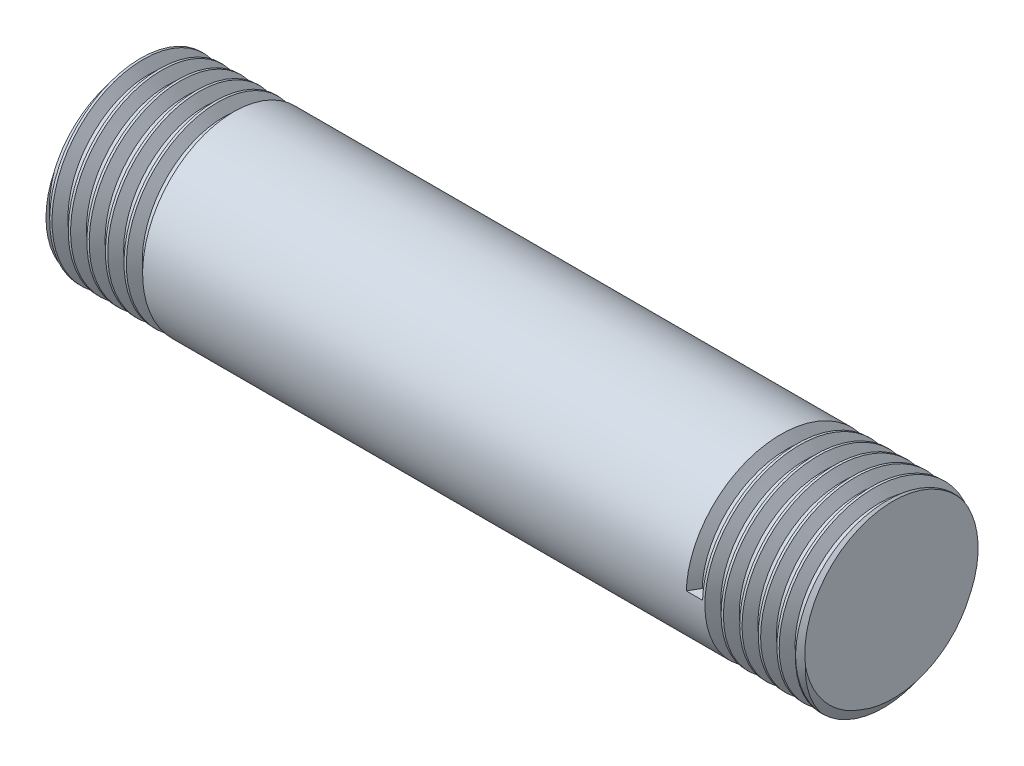
from build123d import *

# Parameters (mm, degrees)
SWEEP1_PROFILE_R = 5
CHAMFER1_SIZE    = 0.25
THREAD1_PITCH    = 1
THREAD2_PITCH    = 1


with BuildPart() as part:
    # Sweep1: sweep along a path in Sketch5
    with BuildLine(Plane.XY) as sweep1_path:
        Line((0, 0), (41, 0))
    # Sweep1 profile (on start of the path) → Sweep1 (sweep)
    with BuildSketch(Plane(origin=(0, 0, 0), x_dir=(0, 0, 1), z_dir=(1, 0, 0))):
        Circle(SWEEP1_PROFILE_R)
    sweep(path=sweep1_path.line)

    # Chamfer1
    chamfer1_edges = [part.edges().sort_by_distance(p)[0] for p in [
        (0, 0, -5),
        (41, 0, -5),
    ]]
    chamfer(chamfer1_edges, length=CHAMFER1_SIZE)

    # Thread1: arcs per turn and ends read off the stored shape
    # Thread1: the profile of Thread Profile1 profile screwed along a left-hand helix through 7 turns, 8 arcs to a turn; built about Z, then put on its axis
    thread1_z = Axis((0, 0, 0), (0, 0, 1))
    thread1_corners = [(5.0003, 0, -0.000173205), (5.0003, 0, 0.875173202), (4.458734125, 0, 0.562499999), (4.458734125, 0, 0.312499999)]
    with BuildLine(mode=Mode.PRIVATE) as thread1_profile:
        Line(thread1_corners[0], thread1_corners[1])
        Line(thread1_corners[1], thread1_corners[2])
        Line(thread1_corners[2], thread1_corners[3])
        Line(thread1_corners[3], thread1_corners[0])
    thread1_cap = Face(thread1_profile.wire())
    thread1_turn_angles = [0, -22.5, -45, -67.5, -90, -112.5, -135, -157.5, -180, -202.5, -225, -247.5, -270, -292.5, -315, -337.5, -360]
    thread1_turn_weights = [1, 0.9238795325112867, 1, 0.9238795325112867, 1, 0.9238795325112867, 1, 0.9238795325112867, 1, 0.9238795325112867, 1, 0.9238795325112867, 1, 0.9238795325112867, 1, 0.9238795325112867, 1]
    thread1_turn_rails = [Edge.make_bspline([Vector(p[0], p[1], 0).rotate(thread1_z, thread1_turn_angles[k]) / thread1_turn_weights[k] + Vector(0, 0, p[2] + -THREAD1_PITCH * thread1_turn_angles[k] / 360) for k in range(17)], [0, 0, 0, 1, 1, 2, 2, 3, 3, 4, 4, 5, 5, 6, 6, 7, 7, 8, 8, 8], 2, thread1_turn_weights) for p in thread1_corners]
    thread1_turn_sides = [Face.make_surface_from_curves(thread1_turn_rails[p[0]], thread1_turn_rails[p[1]]) for p in [(0, 1), (1, 2), (2, 3), (3, 0)]]
    thread1 = Plane(origin=(42.75, 0, 0), x_dir=(0, 0, 1), z_dir=(-1, 0, 0)) * Solid(Shell([*[p.moved(Location((0, 0, THREAD1_PITCH * i))) for i in range(7) for p in thread1_turn_sides], thread1_cap, thread1_cap.rotate(thread1_z, -2520).moved(Location((0, 0, -THREAD1_PITCH * -2520 / 360)))]))
    add(thread1, mode=Mode.SUBTRACT)

    # Thread2: arcs per turn and ends read off the stored shape
    # Thread2: the profile of Thread Profile2 profile screwed along a right-hand helix through 7 turns, 8 arcs to a turn; built about Z, then put on its axis
    thread2_z = Axis((0, 0, 0), (0, 0, 1))
    thread2_corners = [(5.0003, 0, -0.000173205), (5.0003, 0, 0.875173202), (4.458734125, 0, 0.562499999), (4.458734125, 0, 0.312499999)]
    with BuildLine(mode=Mode.PRIVATE) as thread2_profile:
        Line(thread2_corners[0], thread2_corners[1])
        Line(thread2_corners[1], thread2_corners[2])
        Line(thread2_corners[2], thread2_corners[3])
        Line(thread2_corners[3], thread2_corners[0])
    thread2_cap = Face(thread2_profile.wire())
    thread2_turn_angles = [0, 22.5, 45, 67.5, 90, 112.5, 135, 157.5, 180, 202.5, 225, 247.5, 270, 292.5, 315, 337.5, 360]
    thread2_turn_weights = [1, 0.9238795325112867, 1, 0.9238795325112867, 1, 0.9238795325112867, 1, 0.9238795325112867, 1, 0.9238795325112867, 1, 0.9238795325112867, 1, 0.9238795325112867, 1, 0.9238795325112867, 1]
    thread2_turn_rails = [Edge.make_bspline([Vector(p[0], p[1], 0).rotate(thread2_z, thread2_turn_angles[k]) / thread2_turn_weights[k] + Vector(0, 0, p[2] + THREAD2_PITCH * thread2_turn_angles[k] / 360) for k in range(17)], [0, 0, 0, 1, 1, 2, 2, 3, 3, 4, 4, 5, 5, 6, 6, 7, 7, 8, 8, 8], 2, thread2_turn_weights) for p in thread2_corners]
    thread2_turn_sides = [Face.make_surface_from_curves(thread2_turn_rails[p[0]], thread2_turn_rails[p[1]]) for p in [(0, 1), (1, 2), (2, 3), (3, 0)]]
    thread2 = Plane(origin=(-1.75, 0, 0), x_dir=(0, 0, -1), z_dir=(1, 0, 0)) * Solid(Shell([*[p.moved(Location((0, 0, THREAD2_PITCH * i))) for i in range(7) for p in thread2_turn_sides], thread2_cap, thread2_cap.rotate(thread2_z, 2520).moved(Location((0, 0, THREAD2_PITCH * 2520 / 360)))]))
    add(thread2, mode=Mode.SUBTRACT)


solid = part.part
